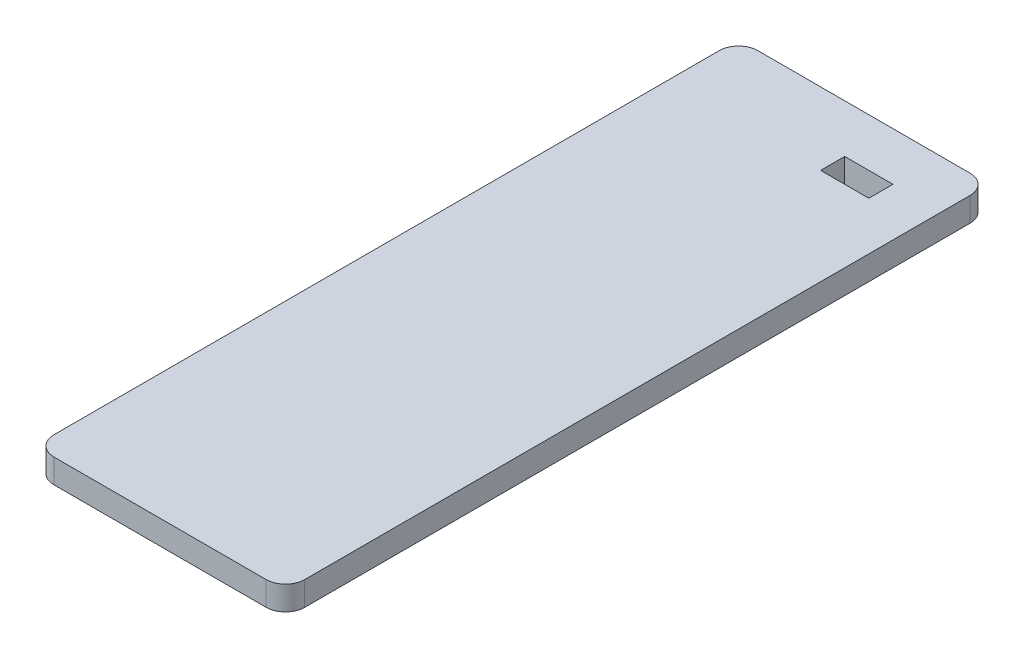
from build123d import *

# Parameters (mm, degrees)
SKETCH1_W           = 33.03
SKETCH1_H           = 92.7
BOSS_EXTRUDE1_DEPTH = 3.175
SKETCH2_W           = 6.35
SKETCH2_H           = 3.175
CUT_EXTRUDE1_DEPTH  = 63.137257853
FILLET1_R           = 2.54


with BuildPart() as part:
    # Sketch1 → Boss-Extrude1 (new body)
    with BuildSketch(Plane(origin=(0, 0, 0), x_dir=(1, 0, 0), z_dir=(0, 1, 0))):
        with Locations((-9.766081081, 9.866216216)):
            Rectangle(SKETCH1_W, SKETCH1_H)
    extrude(amount=BOSS_EXTRUDE1_DEPTH)

    # Sketch2 → Cut-Extrude1 (cut, through all)
    with BuildSketch(Plane(origin=(0, 3.175, 0), x_dir=(1, 0, 0), z_dir=(0, 1, 0))):
        with Locations((-2.776081081, 48.278716216)):
            Rectangle(SKETCH2_W, SKETCH2_H)
    extrude(amount=-CUT_EXTRUDE1_DEPTH, mode=Mode.SUBTRACT)

    # Fillet1
    fillet1_edges = [part.edges().sort_by_distance(p)[0] for p in [
        (-26.281081081, 1.5875, -56.216216216),
        (6.748918919, 1.5875, -56.216216216),
        (6.748918919, 1.5875, 36.483783784),
        (-26.281081081, 1.5875, 36.483783784),
    ]]
    fillet(fillet1_edges, radius=FILLET1_R)


solid = part.part
